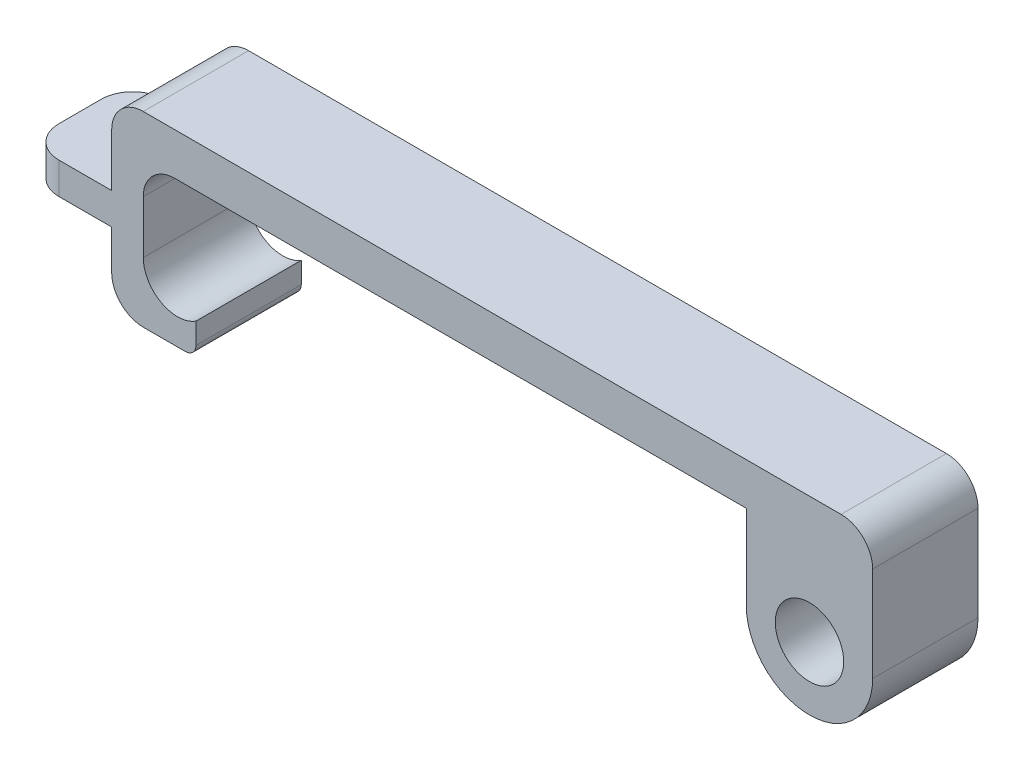
from build123d import *

# Parameters (mm, degrees)
ESQUISSE1_R        = 3.25
BOSS_EXTRU_1_DEPTH = 10
CONG_1_R           = 3
CONG_2_R           = 1


with BuildPart() as part:
    # Esquisse1 → Boss.-Extru.1 (new body)
    with BuildSketch(Plane.XY):
        with BuildLine():
            Line((11.588403104, 18.910210832), (11.588403104, 26.910210832))
            Line((11.588403104, 26.910210832), (-45.661596896, 26.910210832))
            Line((-45.661596896, 26.910210832), (-45.661596896, 18.910210832))
            ThreePointArc((-45.661596896, 18.910210832), (-43.972846395, 16.059772269), (-40.661596896, 16.171598045))
            Line((-40.661596896, 16.171598045), (-40.661596896, 13.171598045))
            Line((-40.661596896, 13.171598045), (-48.661596896, 13.171598045))
            Line((-48.661596896, 13.171598045), (-48.661596896, 19.910210832))
            Line((-48.661596896, 19.910210832), (-56.661596896, 19.910210832))
            Line((-56.661596896, 19.910210832), (-56.661596896, 22.910210832))
            Line((-56.661596896, 22.910210832), (-48.661596896, 22.910210832))
            Line((-48.661596896, 22.910210832), (-48.661596896, 30.910210832))
            Line((-48.661596896, 30.910210832), (23.588403104, 30.910210832))
            Line((23.588403104, 30.910210832), (23.588403104, 18.910210832))
            ThreePointArc((23.588403104, 18.910210832), (17.588403104, 12.910210832), (11.588403104, 18.910210832))
        make_face()
        with Locations((17.588403104, 18.910210832)):
            Circle(ESQUISSE1_R, mode=Mode.SUBTRACT)
    extrude(amount=BOSS_EXTRU_1_DEPTH)

    # Congé1
    cong_1_edges = [part.edges().sort_by_distance(p)[0] for p in [
        (-45.661596896, 26.910210832, 5),
        (-48.661596896, 13.171598045, 5),
        (23.588403104, 30.910210832, 5),
        (-48.661596896, 30.910210832, 5),
        (-56.661596896, 21.410210832, 10),
        (-56.661596896, 21.410210832, 0),
    ]]
    fillet(cong_1_edges, radius=CONG_1_R)

    # Congé2
    cong_2_edges = [part.edges().sort_by_distance(p)[0] for p in [
        (-40.661596896, 13.171598045, 5),
    ]]
    fillet(cong_2_edges, radius=CONG_2_R)


solid = part.part
